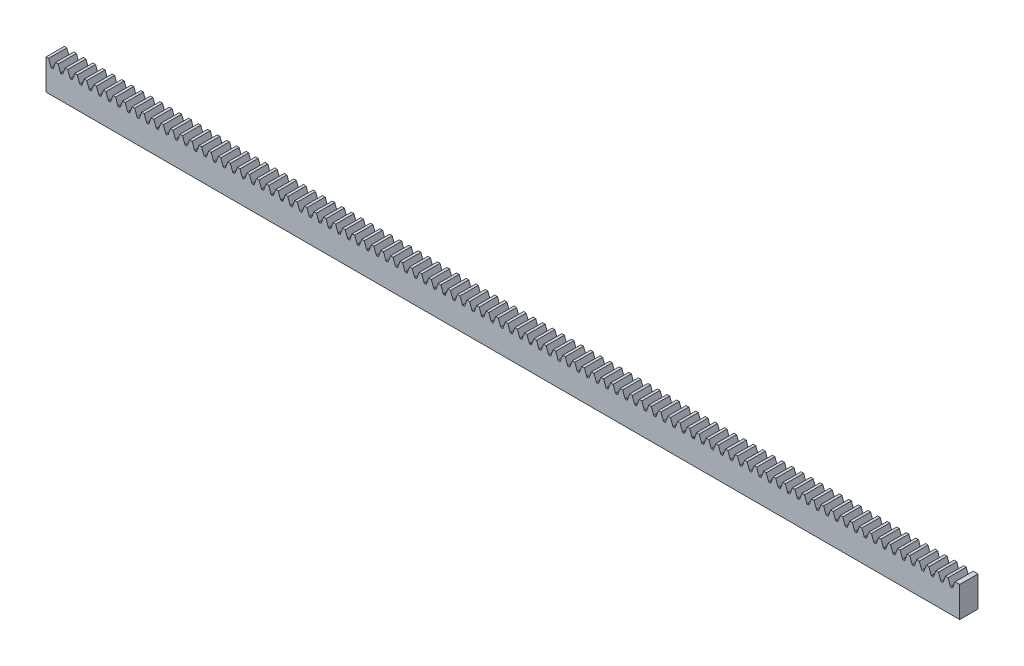
from build123d import *

# Parameters (mm, degrees)
BOSS_EXTRUDE1_DEPTH      = 150
BOSS_EXTRUDE1_DEPTH_BACK = 150
SKETCH2_W                = 6
SKETCH2_H                = 10
TOOTH_CUT_DEPTH          = 151.362894359
FILLET1_R                = 0.198087619
LPATTERN1_COUNT          = 95
LPATTERN1_PITCH          = 3.1416
FILLET1_OF_LPATTERN1_R   = 0.198087619


with BuildPart() as part:
    # Sketch2 → Boss-Extrude1 (new, two sides: drawn at the far end of the back side and taken through both)
    with BuildSketch(Plane(origin=(0, 0, 0), x_dir=(0, 0, -1), z_dir=(1, 0, 0)).offset(-BOSS_EXTRUDE1_DEPTH_BACK)):
        with Locations((0, 5)):
            Rectangle(SKETCH2_W, SKETCH2_H)
    extrude(amount=BOSS_EXTRUDE1_DEPTH + BOSS_EXTRUDE1_DEPTH_BACK)

    # Tooth Cut Sketch → Tooth Cut (cut, symmetric)
    with BuildSketch(Plane.XY):
        Polygon((-149.157140469, 10), (-148.337916265, 7.7492), (-147.677624203, 7.7492), (-146.8584, 10), align=None)
    tooth_cut = extrude(amount=TOOTH_CUT_DEPTH, both=True, mode=Mode.SUBTRACT)

    # Fillet1
    fillet1_edges = [part.edges().sort_by_distance(p)[0] for p in [
        (-147.677624203, 7.7492, 0),
        (-148.337916265, 7.7492, 0),
    ]]
    fillet(fillet1_edges, radius=FILLET1_R)

    # LPattern1: Tooth Cut ×95
    with Locations(*[(i * LPATTERN1_PITCH, 0, 0) for i in range(1, LPATTERN1_COUNT)]):
        add(tooth_cut, mode=Mode.SUBTRACT)

    # Fillet1 of LPattern1
    fillet1_of_lpattern1_edges = [part.edges().sort_by_distance(p)[0] for p in [
        (-144.536024203, 7.7492, 0),
        (-145.196316265, 7.7492, 0),
        (-141.394424203, 7.7492, 0),
        (-142.054716265, 7.7492, 0),
        (-138.252824203, 7.7492, 0),
        (-138.913116265, 7.7492, 0),
        (-135.111224203, 7.7492, 0),
        (-135.771516265, 7.7492, 0),
        (-131.969624203, 7.7492, 0),
        (-132.629916265, 7.7492, 0),
        (-128.828024203, 7.7492, 0),
        (-129.488316265, 7.7492, 0),
        (-125.686424203, 7.7492, 0),
        (-126.346716265, 7.7492, 0),
        (-122.544824203, 7.7492, 0),
        (-123.205116265, 7.7492, 0),
        (-119.403224203, 7.7492, 0),
        (-120.063516265, 7.7492, 0),
        (-116.261624203, 7.7492, 0),
        (-116.921916265, 7.7492, 0),
        (-113.120024203, 7.7492, 0),
        (-113.780316265, 7.7492, 0),
        (-109.978424203, 7.7492, 0),
        (-110.638716265, 7.7492, 0),
        (-106.836824203, 7.7492, 0),
        (-107.497116265, 7.7492, 0),
        (-103.695224203, 7.7492, 0),
        (-104.355516265, 7.7492, 0),
        (-100.553624203, 7.7492, 0),
        (-101.213916265, 7.7492, 0),
        (-97.412024203, 7.7492, 0),
        (-98.072316265, 7.7492, 0),
        (-94.270424203, 7.7492, 0),
        (-94.930716265, 7.7492, 0),
        (-91.128824203, 7.7492, 0),
        (-91.789116265, 7.7492, 0),
        (-87.987224203, 7.7492, 0),
        (-88.647516265, 7.7492, 0),
        (-84.845624203, 7.7492, 0),
        (-85.505916265, 7.7492, 0),
        (-81.704024203, 7.7492, 0),
        (-82.364316265, 7.7492, 0),
        (-78.562424203, 7.7492, 0),
        (-79.222716265, 7.7492, 0),
        (-75.420824203, 7.7492, 0),
        (-76.081116265, 7.7492, 0),
        (-72.279224203, 7.7492, 0),
        (-72.939516265, 7.7492, 0),
        (-69.137624203, 7.7492, 0),
        (-69.797916265, 7.7492, 0),
        (-65.996024203, 7.7492, 0),
        (-66.656316265, 7.7492, 0),
        (-62.854424203, 7.7492, 0),
        (-63.514716265, 7.7492, 0),
        (-59.712824203, 7.7492, 0),
        (-60.373116265, 7.7492, 0),
        (-56.571224203, 7.7492, 0),
        (-57.231516265, 7.7492, 0),
        (-53.429624203, 7.7492, 0),
        (-54.089916265, 7.7492, 0),
        (-50.288024203, 7.7492, 0),
        (-50.948316265, 7.7492, 0),
        (-47.146424203, 7.7492, 0),
        (-47.806716265, 7.7492, 0),
        (-44.004824203, 7.7492, 0),
        (-44.665116265, 7.7492, 0),
        (-40.863224203, 7.7492, 0),
        (-41.523516265, 7.7492, 0),
        (-37.721624203, 7.7492, 0),
        (-38.381916265, 7.7492, 0),
        (-34.580024203, 7.7492, 0),
        (-35.240316265, 7.7492, 0),
        (-31.438424203, 7.7492, 0),
        (-32.098716265, 7.7492, 0),
        (-28.296824203, 7.7492, 0),
        (-28.957116265, 7.7492, 0),
        (-25.155224203, 7.7492, 0),
        (-25.815516265, 7.7492, 0),
        (-22.013624203, 7.7492, 0),
        (-22.673916265, 7.7492, 0),
        (-18.872024203, 7.7492, 0),
        (-19.532316265, 7.7492, 0),
        (-15.730424203, 7.7492, 0),
        (-16.390716265, 7.7492, 0),
        (-12.588824203, 7.7492, 0),
        (-13.249116265, 7.7492, 0),
        (-9.447224203, 7.7492, 0),
        (-10.107516265, 7.7492, 0),
        (-6.305624203, 7.7492, 0),
        (-6.965916265, 7.7492, 0),
        (-3.164024203, 7.7492, 0),
        (-3.824316265, 7.7492, 0),
        (-0.022424203, 7.7492, 0),
        (-0.682716265, 7.7492, 0),
        (3.119175797, 7.7492, 0),
        (2.458883735, 7.7492, 0),
        (6.260775797, 7.7492, 0),
        (5.600483735, 7.7492, 0),
        (9.402375797, 7.7492, 0),
        (8.742083735, 7.7492, 0),
        (12.543975797, 7.7492, 0),
        (11.883683735, 7.7492, 0),
        (15.685575797, 7.7492, 0),
        (15.025283735, 7.7492, 0),
        (18.827175797, 7.7492, 0),
        (18.166883735, 7.7492, 0),
        (21.968775797, 7.7492, 0),
        (21.308483735, 7.7492, 0),
        (25.110375797, 7.7492, 0),
        (24.450083735, 7.7492, 0),
        (28.251975797, 7.7492, 0),
        (27.591683735, 7.7492, 0),
        (31.393575797, 7.7492, 0),
        (30.733283735, 7.7492, 0),
        (34.535175797, 7.7492, 0),
        (33.874883735, 7.7492, 0),
        (37.676775797, 7.7492, 0),
        (37.016483735, 7.7492, 0),
        (40.818375797, 7.7492, 0),
        (40.158083735, 7.7492, 0),
        (43.959975797, 7.7492, 0),
        (43.299683735, 7.7492, 0),
        (47.101575797, 7.7492, 0),
        (46.441283735, 7.7492, 0),
        (50.243175797, 7.7492, 0),
        (49.582883735, 7.7492, 0),
        (53.384775797, 7.7492, 0),
        (52.724483735, 7.7492, 0),
        (56.526375797, 7.7492, 0),
        (55.866083735, 7.7492, 0),
        (59.667975797, 7.7492, 0),
        (59.007683735, 7.7492, 0),
        (62.809575797, 7.7492, 0),
        (62.149283735, 7.7492, 0),
        (65.951175797, 7.7492, 0),
        (65.290883735, 7.7492, 0),
        (69.092775797, 7.7492, 0),
        (68.432483735, 7.7492, 0),
        (72.234375797, 7.7492, 0),
        (71.574083735, 7.7492, 0),
        (75.375975797, 7.7492, 0),
        (74.715683735, 7.7492, 0),
        (78.517575797, 7.7492, 0),
        (77.857283735, 7.7492, 0),
        (81.659175797, 7.7492, 0),
        (80.998883735, 7.7492, 0),
        (84.800775797, 7.7492, 0),
        (84.140483735, 7.7492, 0),
        (87.942375797, 7.7492, 0),
        (87.282083735, 7.7492, 0),
        (91.083975797, 7.7492, 0),
        (90.423683735, 7.7492, 0),
        (94.225575797, 7.7492, 0),
        (93.565283735, 7.7492, 0),
        (97.367175797, 7.7492, 0),
        (96.706883735, 7.7492, 0),
        (100.508775797, 7.7492, 0),
        (99.848483735, 7.7492, 0),
        (103.650375797, 7.7492, 0),
        (102.990083735, 7.7492, 0),
        (106.791975797, 7.7492, 0),
        (106.131683735, 7.7492, 0),
        (109.933575797, 7.7492, 0),
        (109.273283735, 7.7492, 0),
        (113.075175797, 7.7492, 0),
        (112.414883735, 7.7492, 0),
        (116.216775797, 7.7492, 0),
        (115.556483735, 7.7492, 0),
        (119.358375797, 7.7492, 0),
        (118.698083735, 7.7492, 0),
        (122.499975797, 7.7492, 0),
        (121.839683735, 7.7492, 0),
        (125.641575797, 7.7492, 0),
        (124.981283735, 7.7492, 0),
        (128.783175797, 7.7492, 0),
        (128.122883735, 7.7492, 0),
        (131.924775797, 7.7492, 0),
        (131.264483735, 7.7492, 0),
        (135.066375797, 7.7492, 0),
        (134.406083735, 7.7492, 0),
        (138.207975797, 7.7492, 0),
        (137.547683735, 7.7492, 0),
        (141.349575797, 7.7492, 0),
        (140.689283735, 7.7492, 0),
        (144.491175797, 7.7492, 0),
        (143.830883735, 7.7492, 0),
        (147.632775797, 7.7492, 0),
        (146.972483735, 7.7492, 0),
    ]]
    fillet(fillet1_of_lpattern1_edges, radius=FILLET1_OF_LPATTERN1_R)


solid = part.part
